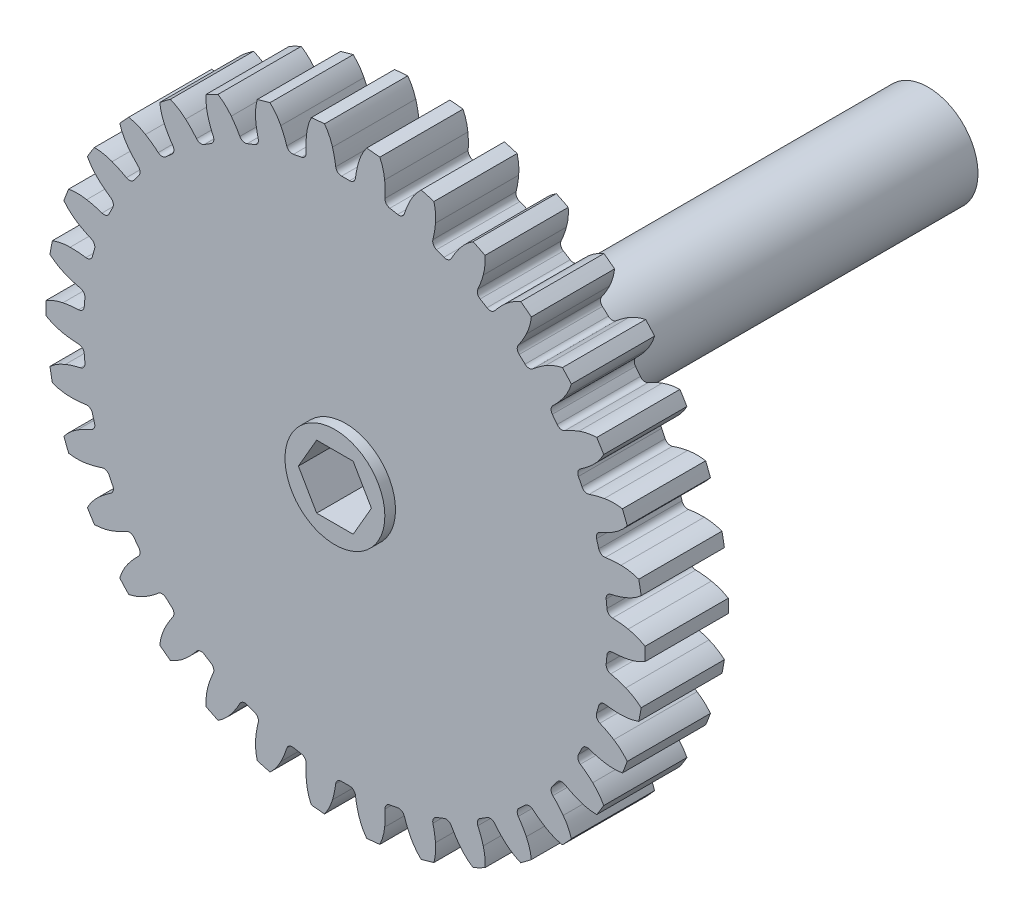
from build123d import *

# Parameters (mm, degrees)
SKETCH1_R           = 22.86
ROUND_STOCK_DEPTH   = 3.175
SINGLE_TOOTH_DEPTH  = 33.946649299
TOOTH_PATTERN_COUNT = 34
CUT_EXTRUDE1_DEPTH  = 33.907595949
SKETCH8_R           = 3.81
BOSS_EXTRUDE1_DEPTH = 38.1
CHAMFER1_SIZE       = 1.27
BOSS_EXTRUDE2_START = 0.8128
SKETCH9_R           = 3.81
BOSS_EXTRUDE2_DEPTH = 0.8128


with BuildPart() as part:
    # Sketch1 → Round Stock (new, symmetric)
    with BuildSketch(Plane.XY):
        Circle(SKETCH1_R)
    extrude(amount=ROUND_STOCK_DEPTH, both=True)

    # Sketch2 → Single Tooth (cut, through all)
    with BuildSketch(Plane.XY.offset(3.175)):
        with BuildLine():
            ThreePointArc((-22.558432369, -3.700909222), (-22.76248327, -2.109254697), (-22.854372474, -0.507206861))
            ThreePointArc((-22.854372474, -0.507206861), (-22.231979391, -0.808376737), (-21.566940538, -0.997585))
            ThreePointArc((-21.566940538, -0.997585), (-20.971743487, -1.08827056), (-20.371269004, -1.132017494))
            ThreePointArc((-20.371269004, -1.132017494), (-20.07878157, -1.255170527), (-19.942974638, -1.542001568))
            ThreePointArc((-19.942974638, -1.542001568), (-19.917172861, -1.84559786), (-19.886749641, -2.148765913))
            ThreePointArc((-19.886749641, -2.148765913), (-19.967539137, -2.455667568), (-20.232417106, -2.630468111))
            ThreePointArc((-20.232417106, -2.630468111), (-20.814628892, -2.783807068), (-21.383028154, -2.982315705))
            ThreePointArc((-21.383028154, -2.982315705), (-22.00197653, -3.290502907), (-22.558432369, -3.700909222))
        make_face()
    single_tooth = extrude(amount=-SINGLE_TOOTH_DEPTH, mode=Mode.SUBTRACT)

    # Tooth Pattern: Single Tooth ×34 about axis
    tooth_pattern_axis = Axis((0, 0, 50), (0, 0, -1))
    for i in range(1, TOOTH_PATTERN_COUNT):
        add(single_tooth.rotate(tooth_pattern_axis, i * 360 / TOOTH_PATTERN_COUNT), mode=Mode.SUBTRACT)

    # Sketch7 → Cut-Extrude1 (cut, through all)
    with BuildSketch(Plane(origin=(0, 0, -3.175), x_dir=(-1, 0, 0), z_dir=(0, 0, -1))):
        Polygon((1.3931462, -2.413), (2.786292399, 0), (1.3931462, 2.413), (-1.3931462, 2.413), (-2.786292399, 0), (-1.3931462, -2.413), align=None)
    extrude(amount=-CUT_EXTRUDE1_DEPTH, mode=Mode.SUBTRACT)

    # Sketch8 → Boss-Extrude1 (add)
    with BuildSketch(Plane(origin=(0, 0, -3.175), x_dir=(-1, 0, 0), z_dir=(0, 0, -1))):
        Circle(SKETCH8_R)
        Polygon((1.3931462, -2.413), (2.786292399, 0), (1.3931462, 2.413), (-1.3931462, 2.413), (-2.786292399, 0), (-1.3931462, -2.413), align=None, mode=Mode.SUBTRACT)
    extrude(amount=BOSS_EXTRUDE1_DEPTH)

    # Chamfer1
    chamfer1_edges = [part.edges().sort_by_distance(p)[0] for p in [
        (3.81, 0, -3.175),
    ]]
    chamfer(chamfer1_edges, length=CHAMFER1_SIZE)

    # Sketch9 → Boss-Extrude2 (add)
    with BuildSketch(Plane.XY.offset(3.175).offset(BOSS_EXTRUDE2_START)):
        Circle(SKETCH9_R)
        Polygon((-1.3931462, -2.413), (1.3931462, -2.413), (2.786292399, 0), (1.3931462, 2.413), (-1.3931462, 2.413), (-2.786292399, 0), align=None, mode=Mode.SUBTRACT)
    extrude(amount=-BOSS_EXTRUDE2_DEPTH)


solid = part.part
